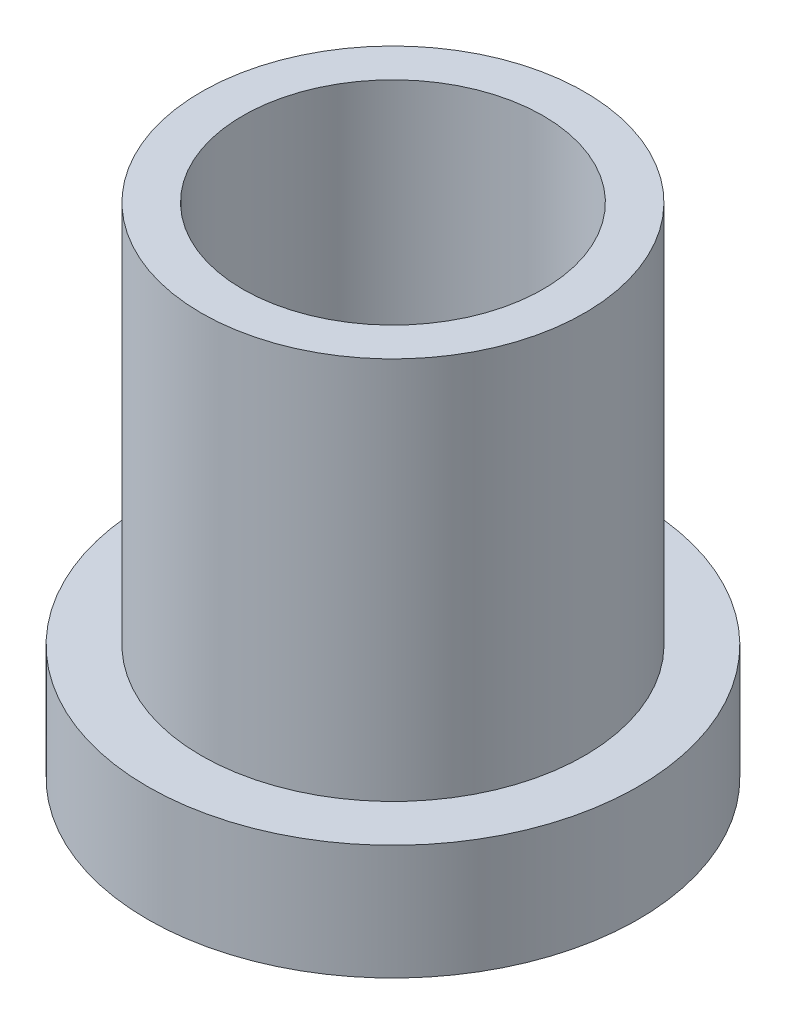
from build123d import *

# Parameters (mm, degrees)
SKETCH1_R           = 3.175
SKETCH1_R_2         = 2.4892
BOSS_EXTRUDE1_DEPTH = 6.35
SKETCH2_R           = 4.064
BOSS_EXTRUDE2_DEPTH = 1.905
SKETCH3_R           = 2.4892
CUT_EXTRUDE1_DEPTH  = 11.058688632


with BuildPart() as part:
    # Sketch1 → Boss-Extrude1 (new body)
    with BuildSketch(Plane(origin=(0, 0, 0), x_dir=(1, 0, 0), z_dir=(0, 1, 0))):
        Circle(SKETCH1_R)
        Circle(SKETCH1_R_2, mode=Mode.SUBTRACT)
    extrude(amount=BOSS_EXTRUDE1_DEPTH)

    # Sketch2 → Boss-Extrude2 (add)
    with BuildSketch(Plane.XZ):
        Circle(SKETCH2_R)
    extrude(amount=BOSS_EXTRUDE2_DEPTH)

    # Sketch3 → Cut-Extrude1 (cut, through all)
    with BuildSketch(Plane.XZ.offset(1.905)):
        Circle(SKETCH3_R)
    extrude(amount=-CUT_EXTRUDE1_DEPTH, mode=Mode.SUBTRACT)


solid = part.part
